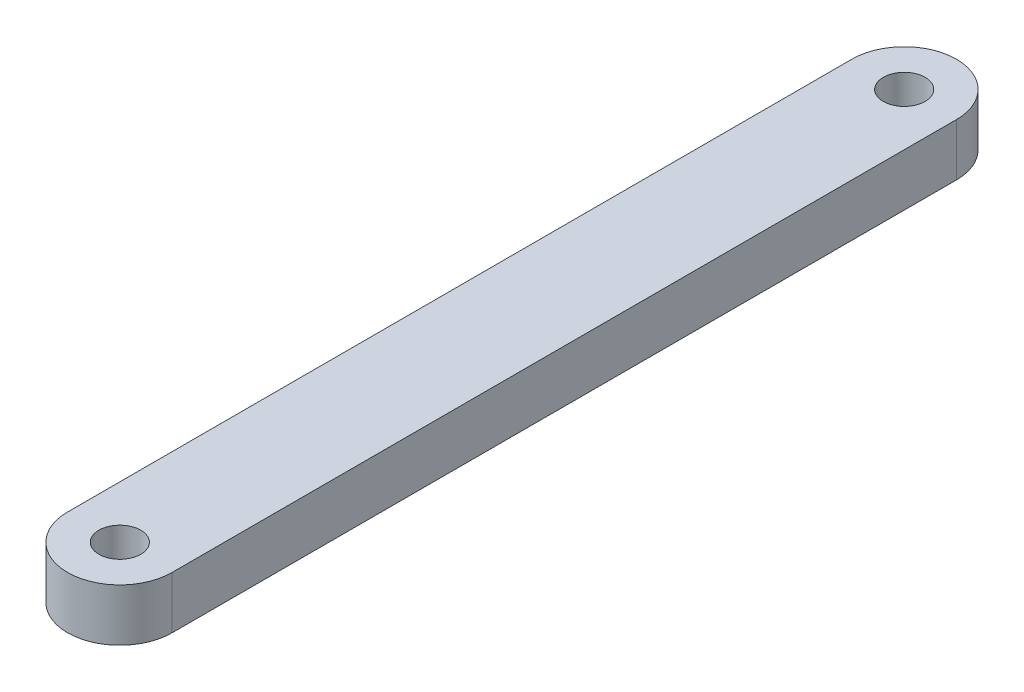
from build123d import *

# Parameters (mm, degrees)
SKETCH1_R           = 2
BOSS_EXTRUDE1_DEPTH = 5


with BuildPart() as part:
    # Sketch1 → Boss-Extrude1 (new body)
    with BuildSketch(Plane(origin=(0, 0, 0), x_dir=(1, 0, 0), z_dir=(0, 1, 0))):
        with BuildLine():
            Line((5, 37.5), (5, -37.5))
            ThreePointArc((5, -37.5), (0, -42.5), (-5, -37.5))
            Line((-5, -37.5), (-5, 37.5))
            ThreePointArc((-5, 37.5), (0, 42.5), (5, 37.5))
        make_face()
        with Locations((0, 37.5)):
            Circle(SKETCH1_R, mode=Mode.SUBTRACT)
        with Locations((0, -37.5)):
            Circle(SKETCH1_R, mode=Mode.SUBTRACT)
    extrude(amount=BOSS_EXTRUDE1_DEPTH)


solid = part.part
